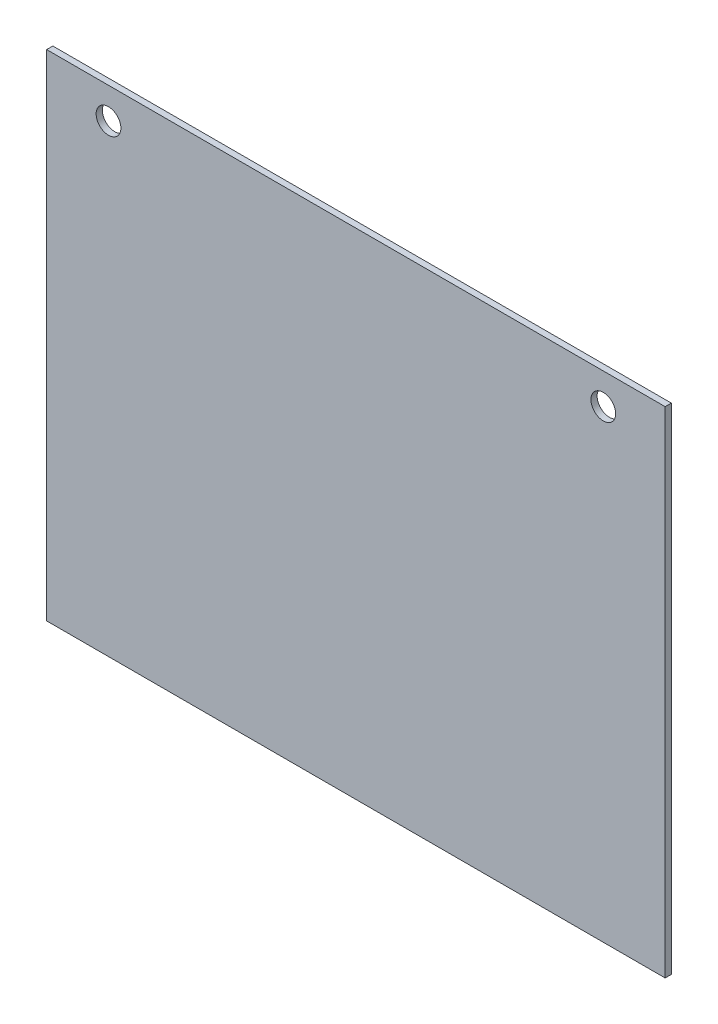
from build123d import *

# Parameters (mm, degrees)
ESQUISSE1_W               = 100
ESQUISSE1_H               = 1
T_LE_DE_BASE_PLI_E1_DEPTH = 80
ESQUISSE6_R               = 2
ENL_V_MAT_EXTRU_1_DEPTH   = 95.345111161


# Sheet-metal steps are written as plain solids
with BuildPart() as part:
    # Esquisse1 → Tôle de base pliée1 (new body)
    with BuildSketch(Plane(origin=(0, 0, 0), x_dir=(1, 0, 0), z_dir=(0, 1, 0))):
        with Locations((0, -0.5)):
            Rectangle(ESQUISSE1_W, ESQUISSE1_H)
    extrude(amount=T_LE_DE_BASE_PLI_E1_DEPTH)

    # Esquisse6 → Enlèv. mat.-Extru.1 (cut, through all)
    with BuildSketch(Plane.XY.offset(1)):
        with Locations((-40, 75)):
            Circle(ESQUISSE6_R)
        with Locations((40, 75)):
            Circle(ESQUISSE6_R)
    extrude(amount=-ENL_V_MAT_EXTRU_1_DEPTH, mode=Mode.SUBTRACT)


solid = part.part
